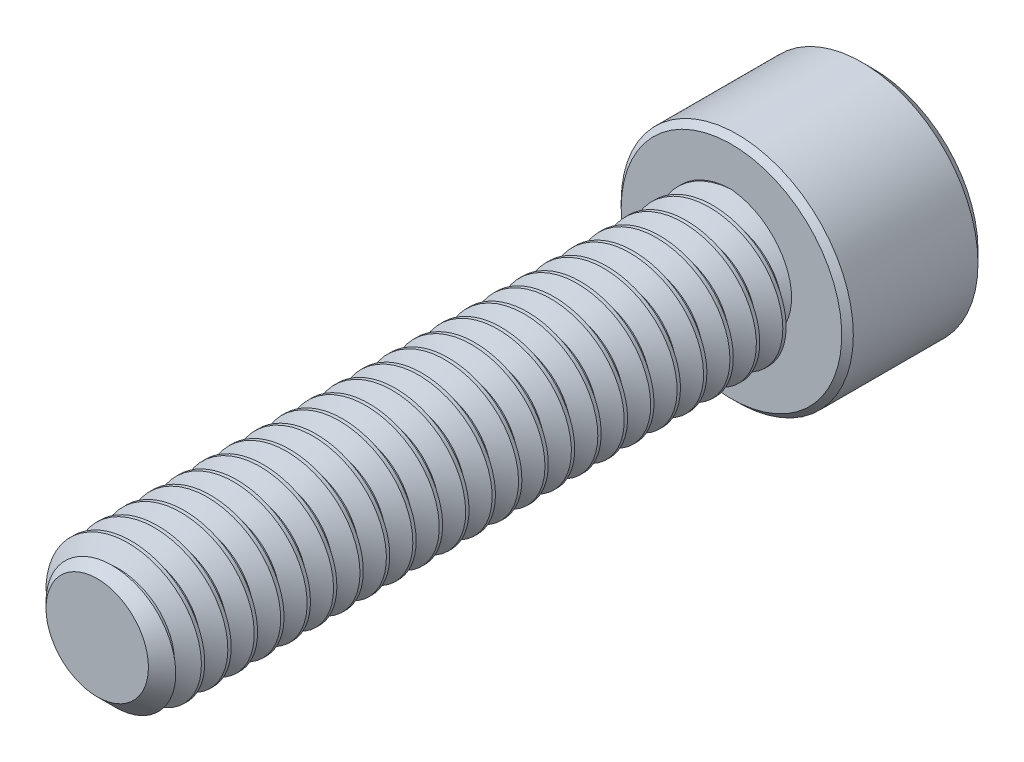
from build123d import *

# Parameters (mm, degrees)
SKETCH1_R          = 1.4224
EXTRUDE1_DEPTH     = 12.7
CHAMFER3_SIZE      = 0.396875
CUT_SWEEP1_PITCH   = 0.529166667
SKETCH6_R          = 2.3241
EXTRUDE2_DEPTH     = 2.8448
CUT_EXTRUDE1_DEPTH = 1.7859375
CHAMFER1_SIZE      = 0.23241
CHAMFER2_SIZE      = 0.116205


with BuildPart() as part:
    # Sketch1 → Extrude1 (new body)
    with BuildSketch(Plane.XY):
        Circle(SKETCH1_R)
    extrude(amount=-EXTRUDE1_DEPTH)

    # Chamfer3
    chamfer3_edges = [part.edges().sort_by_distance(p)[0] for p in [
        (-1.4224, 0, 0),
    ]]
    chamfer(chamfer3_edges, length=CHAMFER3_SIZE)

    # Cut-Sweep1: the profile of Sketch3 profile screwed along a right-hand helix of 25 turns, 6 arcs to a turn; built about Z, then put on its axis
    cut_sweep1_z = Axis((0, 0, 0), (0, 0, 1))
    cut_sweep1_corners = [(1.4227, 0, -0.463194038), (1.078696168, 0, -0.264583333), (1.078696168, 0, -0.1984375), (1.4227, 0, 0.000173205)]
    with BuildLine(mode=Mode.PRIVATE) as cut_sweep1_profile:
        Line(cut_sweep1_corners[0], cut_sweep1_corners[1])
        Line(cut_sweep1_corners[1], cut_sweep1_corners[2])
        Line(cut_sweep1_corners[2], cut_sweep1_corners[3])
        Line(cut_sweep1_corners[3], cut_sweep1_corners[0])
    cut_sweep1_cap = Face(cut_sweep1_profile.wire())
    cut_sweep1_turn_angles = [0, 30, 60, 90, 120, 150, 180, 210, 240, 270, 300, 330, 360]
    cut_sweep1_turn_weights = [1, 0.8660254037844387, 1, 0.8660254037844387, 1, 0.8660254037844387, 1, 0.8660254037844387, 1, 0.8660254037844387, 1, 0.8660254037844387, 1]
    cut_sweep1_turn_rails = [Edge.make_bspline([Vector(p[0], p[1], 0).rotate(cut_sweep1_z, cut_sweep1_turn_angles[k]) / cut_sweep1_turn_weights[k] + Vector(0, 0, p[2] + CUT_SWEEP1_PITCH * cut_sweep1_turn_angles[k] / 360) for k in range(13)], [0, 0, 0, 1, 1, 2, 2, 3, 3, 4, 4, 5, 5, 6, 6, 6], 2, cut_sweep1_turn_weights) for p in cut_sweep1_corners]
    cut_sweep1_turn_sides = [Face.make_surface_from_curves(cut_sweep1_turn_rails[p[0]], cut_sweep1_turn_rails[p[1]]) for p in [(0, 1), (1, 2), (2, 3), (3, 0)]]
    cut_sweep1 = Plane(origin=(0, 0, 0), x_dir=(0, 1, 0), z_dir=(0, 0, -1)) * Solid(Shell([*[p.moved(Location((0, 0, CUT_SWEEP1_PITCH * i))) for i in range(25) for p in cut_sweep1_turn_sides], cut_sweep1_cap, cut_sweep1_cap.rotate(cut_sweep1_z, 9000).moved(Location((0, 0, CUT_SWEEP1_PITCH * 9000 / 360)))]))
    add(cut_sweep1, mode=Mode.SUBTRACT)

    # Sketch6 → Extrude2 (add)
    with BuildSketch(Plane(origin=(0, 0, -12.7), x_dir=(-1, 0, 0), z_dir=(0, 0, -1))):
        Circle(SKETCH6_R)
    extrude(amount=EXTRUDE2_DEPTH)

    # Sketch7 → Cut-Extrude1 (cut)
    with BuildSketch(Plane(origin=(0, 0, -15.5448), x_dir=(-1, 0, 0), z_dir=(0, 0, -1))):
        Polygon((0, 1.374815329), (-1.190625, 0.687407664), (-1.190625, -0.687407664), (0, -1.374815329), (1.190625, -0.687407664), (1.190625, 0.687407664), align=None)
    extrude(amount=-CUT_EXTRUDE1_DEPTH, mode=Mode.SUBTRACT)

    # Cut-Extrude2 cone 1 section (through the dimple's axis) → Cut-Extrude2 (revolve, cut)
    with BuildSketch(Plane(origin=(0, 0, -15.5448), x_dir=(0, 1, 0), z_dir=(1, 0, 0))):
        Polygon((0, 0), (1.374815329, 0), (0, 1.374815329), align=None)
    revolve(axis=Axis((0, 0, -15.5448), (0, 0, 1)), mode=Mode.SUBTRACT)

    # Chamfer1
    chamfer1_edges = [part.edges().sort_by_distance(p)[0] for p in [
        (2.3241, 0, -15.5448),
    ]]
    chamfer(chamfer1_edges, length=CHAMFER1_SIZE)

    # Chamfer2
    chamfer2_edges = [part.edges().sort_by_distance(p)[0] for p in [
        (2.3241, 0, -12.7),
    ]]
    chamfer(chamfer2_edges, length=CHAMFER2_SIZE)


solid = part.part
